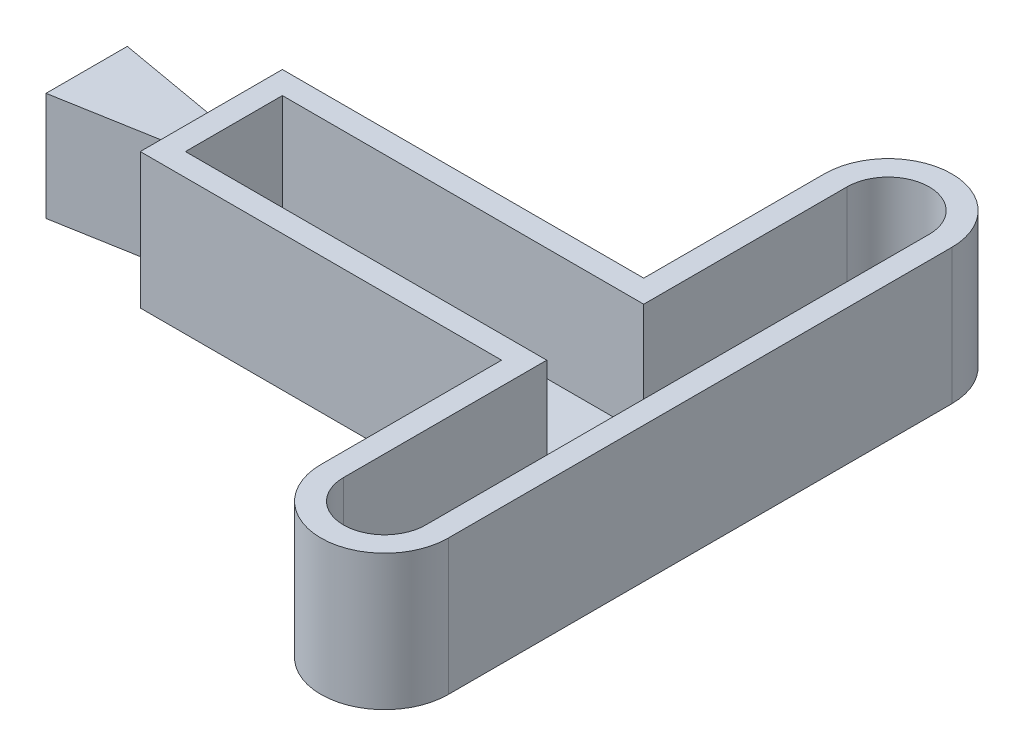
from build123d import *

# Parameters (mm, degrees)
BOSS_EXTRUDE1_DEPTH = 38.1
CUT_EXTRUDE10_DEPTH = 7.62
SHELL2_START        = 6.35
SHELL2_DEPTH        = 31.75
SHELL2_2_DEPTH      = 17.78


# Read off the part's stored shape, not the designer's step: Shell2
with BuildPart() as part:
    # Sketch1 → Boss-Extrude1 (new body)
    with BuildSketch(Plane(origin=(0, 0, 0), x_dir=(1, 0, 0), z_dir=(0, 1, 0))):
        with BuildLine():
            Line((0, 11.43), (0, -11.43))
            Line((0, -11.43), (35.052, -5.249386672))
            Line((35.052, -5.249386672), (35.052, -19.981386672))
            Line((35.052, -19.981386672), (136.652, -19.981386672))
            Line((136.652, -19.981386672), (136.652, -70.781386672))
            ThreePointArc((136.652, -70.781386672), (154.559, -88.688386672), (172.466, -70.781386672))
            Line((172.466, -70.781386672), (172.466, 70.781386672))
            ThreePointArc((172.466, 70.781386672), (154.559, 88.688386672), (136.652, 70.781386672))
            Line((136.652, 70.781386672), (136.652, 19.981386672))
            Line((136.652, 19.981386672), (35.052, 19.981386672))
            Line((35.052, 19.981386672), (35.052, 5.249386672))
            Line((35.052, 5.249386672), (0, 11.43))
        make_face()
    extrude(amount=BOSS_EXTRUDE1_DEPTH)

    # Sketch5 → Cut-Extrude10 (cut)
    with BuildSketch(Plane(origin=(0, 38.1, 0), x_dir=(1, 0, 0), z_dir=(0, 1, 0))):
        Polygon((0, -11.43), (0, 11.43), (0.210478784, 11.603037745), (35.052, 5.249386672), (35.052, -5.249386672), align=None)
    extrude(amount=-CUT_EXTRUDE10_DEPTH, mode=Mode.SUBTRACT)

    # Shell2 outline → Shell2 (cut)
    with BuildSketch(Plane(origin=(0, 0, 0), x_dir=(1, 0, 0), z_dir=(0, 1, 0)).offset(SHELL2_START)):
        with BuildLine():
            Line((41.402, 13.631386672), (41.402, -13.631386672))
            Line((41.402, -13.631386672), (143.002, -13.631386672))
            Line((143.002, -13.631386672), (143.002, -70.781386672))
            ThreePointArc((143.002, -70.781386672), (154.559, -82.338386672), (166.116, -70.781386672))
            Line((166.116, -70.781386672), (166.116, 70.781386672))
            ThreePointArc((166.116, 70.781386672), (154.559, 82.338386672), (143.002, 70.781386672))
            Line((143.002, 70.781386672), (143.002, 13.631386672))
            Line((143.002, 13.631386672), (41.402, 13.631386672))
        make_face()
    extrude(amount=SHELL2_DEPTH, mode=Mode.SUBTRACT)

    # Shell2 2 outline → Shell2 2 (cut)
    with BuildSketch(Plane(origin=(0, 0, 0), x_dir=(1, 0, 0), z_dir=(0, 1, 0)).offset(SHELL2_START)):
        Polygon((28.25455863, 0), (6.35, 3.862364687), (6.35, -3.862364687), align=None)
    extrude(amount=SHELL2_2_DEPTH, mode=Mode.SUBTRACT)


solid = part.part
